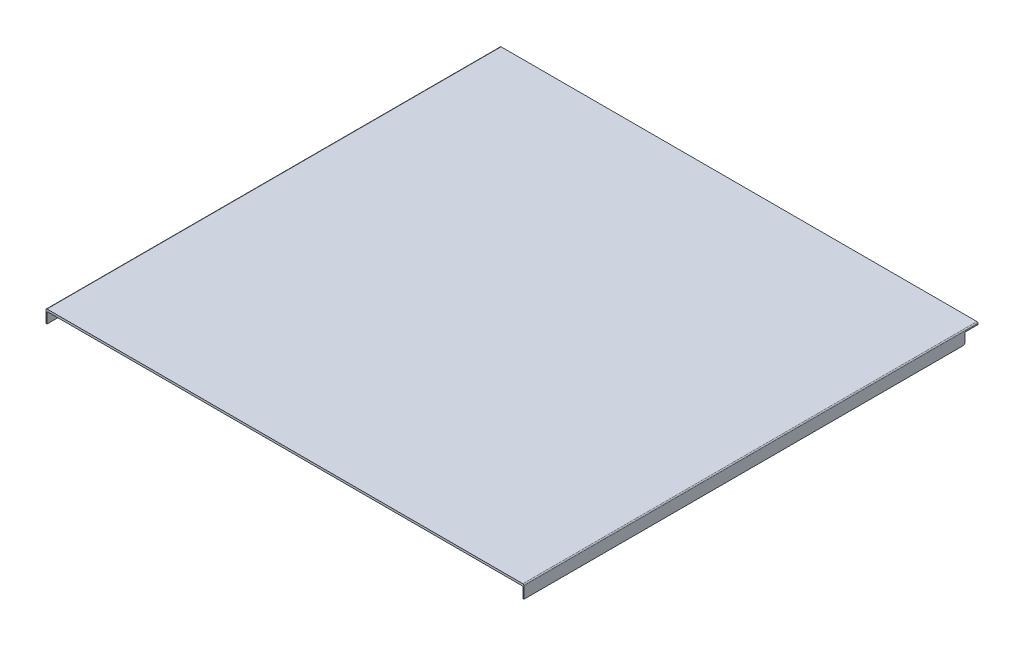
from build123d import *

# Parameters (mm, degrees)
SKETCH1_W           = 442
SKETCH1_H           = 420
BOSS_EXTRUDE1_DEPTH = 2
SKETCH2_W           = 1
SKETCH2_H           = 408
BOSS_EXTRUDE2_DEPTH = 10
FILLET1_R           = 2
FILLET2_R           = 0.5
FILLET3_R           = 1
FILLET4_R           = 0.5


with BuildPart() as part:
    # Sketch1 → Boss-Extrude1 (new body)
    with BuildSketch(Plane(origin=(0, 0, 0), x_dir=(1, 0, 0), z_dir=(0, 1, 0))):
        Rectangle(SKETCH1_W, SKETCH1_H)
    extrude(amount=BOSS_EXTRUDE1_DEPTH)

    # Sketch2 → Boss-Extrude2 (add)
    with BuildSketch(Plane.XZ):
        with Locations((220.5, 6)):
            Rectangle(SKETCH2_W, SKETCH2_H)
        with Locations((-220.5, 6)):
            Rectangle(SKETCH2_W, SKETCH2_H)
    extrude(amount=BOSS_EXTRUDE2_DEPTH)

    # Fillet1
    fillet1_edges = [part.edges().sort_by_distance(p)[0] for p in [
        (220.5, -10, -198),
        (-220.5, -10, -198),
    ]]
    fillet(fillet1_edges, radius=FILLET1_R)

    # Fillet2
    fillet2_edges = [part.edges().sort_by_distance(p)[0] for p in [
        (220.5, 0, -198),
        (-220.5, 0, -198),
    ]]
    fillet(fillet2_edges, radius=FILLET2_R)

    # Fillet3
    fillet3_edges = [part.edges().sort_by_distance(p)[0] for p in [
        (221, 2, 0),
        (-221, 2, 0),
    ]]
    fillet(fillet3_edges, radius=FILLET3_R)

    # Fillet4
    fillet4_edges = [part.edges().sort_by_distance(p)[0] for p in [
        (-220, 0, 5.75),
        (220, 0, 5.75),
    ]]
    fillet(fillet4_edges, radius=FILLET4_R)


solid = part.part
